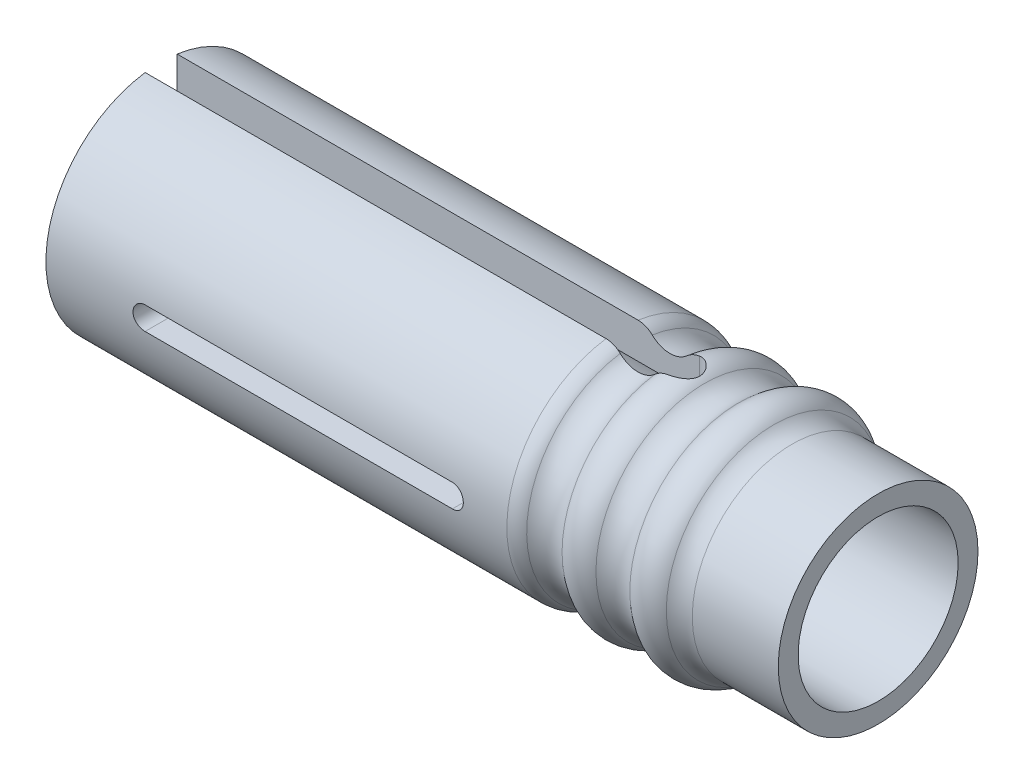
from build123d import *

# Parameters (mm, degrees)
CUT_EXTRUDE1_DEPTH           = 73.933834429
CUT_EXTRUDE2_DEPTH           = 73.933834432
F_5_8_0_625_DIAMETER_HOLE1_D = 15.875


with BuildPart() as part:
    # Sketch1 → Revolve1 (revolve)
    with BuildSketch(Plane.XY):
        with BuildLine():
            Line((0, 0), (71.12, 0))
            Line((71.12, 0), (71.12, 9.906))
            Line((71.12, 9.906), (62.590432635, 9.906))
            ThreePointArc((62.590432635, 9.906), (61.606694865, 10.104235708), (60.776509814, 10.668))
            ThreePointArc((60.776509814, 10.668), (59.054850711, 11.428323739), (57.282534911, 10.795))
            ThreePointArc((57.282534911, 10.795), (55.602482828, 10.16), (53.922430745, 10.795))
            ThreePointArc((53.922430745, 10.795), (52.242378663, 11.43), (50.56232658, 10.795))
            ThreePointArc((50.56232658, 10.795), (48.830141803, 10.16053506), (47.125455332, 10.865555556))
            ThreePointArc((47.125455332, 10.865555556), (46.477281688, 11.283616198), (45.72, 11.43))
            Line((45.72, 11.43), (0, 11.43))
            Line((0, 11.43), (0, 0))
        make_face()
    revolve(axis=Axis((0, 0, 0), (1, 0, 0)))

    # Sketch7 → Cut-Extrude1 (cut, through all)
    with BuildSketch(Plane.XY):
        with BuildLine():
            Line((9.779, 1.143), (40.259, 1.143))
            ThreePointArc((40.259, 1.143), (41.402, 0), (40.259, -1.143))
            Line((40.259, -1.143), (9.779, -1.143))
            ThreePointArc((9.779, -1.143), (8.636, 0), (9.779, 1.143))
        make_face()
    extrude(amount=CUT_EXTRUDE1_DEPTH, mode=Mode.SUBTRACT)

    # Sketch8 → Cut-Extrude2 (cut, through all)
    with BuildSketch(Plane(origin=(0, 0, 0), x_dir=(1, 0, 0), z_dir=(0, 1, 0))):
        with BuildLine():
            Line((0, -1.5875), (51.826930745, -1.5875))
            ThreePointArc((51.826930745, -1.5875), (53.414430745, 0), (51.826930745, 1.5875))
            Line((51.826930745, 1.5875), (0, 1.5875))
            Line((0, 1.5875), (0, -1.5875))
        make_face()
    extrude(amount=CUT_EXTRUDE2_DEPTH, mode=Mode.SUBTRACT)

    # 5/8 (0.625) Diameter Hole1 (through all)
    with Locations(Plane(origin=(71.12, 0, 0), x_dir=(0, 0, -1), z_dir=(1, 0, 0))):
        with Locations((0, 0)):
            Hole(F_5_8_0_625_DIAMETER_HOLE1_D / 2)


solid = part.part
